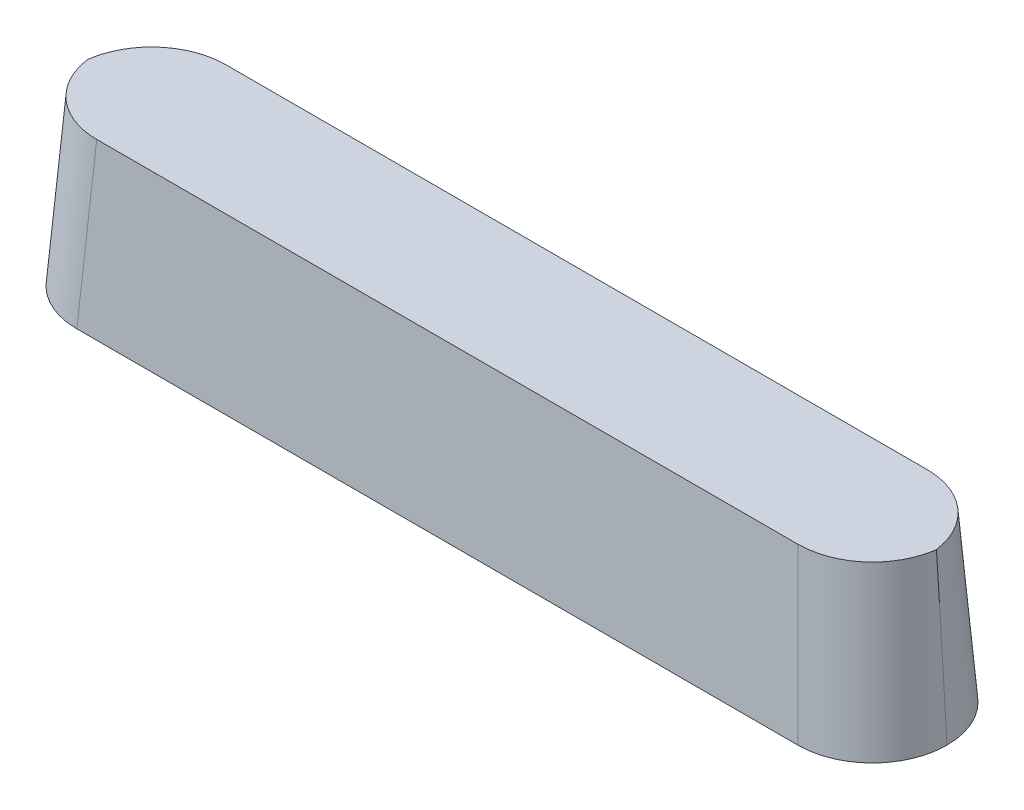
from build123d import *

# Parameters (mm, degrees)
FILLET_1_R = 15


with BuildPart() as part:
    # 草图1 → 放样1 section 0
    with BuildSketch(Plane(origin=(0, 0, 0), x_dir=(1, 0, 0), z_dir=(0, 1, 0))):
        with BuildLine():
            Line((87.50000000000003, -14.999999999999991), (-87.49999999999997, -15.000000000000012))
            Line((-87.49999999999997, -15.000000000000012), (-87.49999999999997, 14.999999999999986))
            Line((-87.49999999999997, 14.999999999999986), (87.50000000000003, 15.000000000000007))
            Line((87.50000000000003, 15.000000000000007), (87.50000000000003, -14.999999999999991))
        make_face()
    # 草图2 → 放样1 section 1
    with BuildSketch(Plane(origin=(0, 33, 0), x_dir=(1, 0, 0), z_dir=(0, 1, 0))):
        with BuildLine():
            Line((85.50000000000001, 13.000000000000007), (-85.49999999999997, 13.000000000000007))
            Line((-85.49999999999997, 13.000000000000007), (-85.49999999999997, -12.999999999999991))
            Line((-85.49999999999997, -12.999999999999991), (85.50000000000001, -12.999999999999991))
            Line((85.50000000000001, -12.999999999999991), (85.50000000000001, 13.000000000000007))
        make_face()
    loft()

    # 圆角1
    # the kernel refuses this fillet: 15 mm, written as the material it takes off along each edge
    with BuildSketch(Plane(origin=(89.75615314494081, -37.226526891522596, -17.25615314494077), x_dir=(-0.99817518096122, -0.0602740731413001, -0.0036529741297753678), z_dir=(-0.06038466786391727, 0.9963470197546278, 0.06038466786391684))) as fillet_1_piece_1:
        with BuildLine():
            CenterArc((FILLET_1_R * 0.996347019755, FILLET_1_R), FILLET_1_R, 180.20968310121904, 89.79031689878093)
            Line((-FILLET_1_R * 0.00364628369535, FILLET_1_R * 0.996340347667), (0, 0))
            Line((0, 0), (FILLET_1_R * 0.996347019755, 1e-17))
        make_face()
    extrude(amount=107.84701680495597, mode=Mode.SUBTRACT)
    with BuildSketch(Plane(origin=(89.7561531449408, -37.226526891522376, 17.25615314494074), x_dir=(-0.9981751809612202, -0.06027407314129964, 0.003652974129776053), z_dir=(-0.06038466786391684, 0.9963470197546278, -0.06038466786391684))) as fillet_1_piece_2:
        with BuildLine():
            CenterArc((FILLET_1_R * 0.996347019755, -FILLET_1_R), FILLET_1_R, 89.99999999999999, 89.79031689878094)
            Line((-FILLET_1_R * 0.00364628369535, -FILLET_1_R * 0.996340347667), (0, 0))
            Line((0, 0), (FILLET_1_R * 0.996347019755, 0))
        make_face()
    extrude(amount=107.84701680495557, mode=Mode.SUBTRACT)
    with BuildSketch(Plane(origin=(-89.75615314494071, -37.226526891522205, -17.256153144940704), x_dir=(-0.0036529741297760742, -0.06027407314129905, 0.9981751809612202), z_dir=(0.06038466786391684, 0.9963470197546278, 0.06038466786391625))) as fillet_1_piece_3:
        with BuildLine():
            CenterArc((FILLET_1_R * 0.996347019755, FILLET_1_R), FILLET_1_R, 180.20968310121907, 89.79031689878093)
            Line((-FILLET_1_R * 0.00364628369535, FILLET_1_R * 0.996340347667), (0, 0))
            Line((0, 0), (FILLET_1_R * 0.996347019755, -1e-17))
        make_face()
    extrude(amount=107.84701680495523, mode=Mode.SUBTRACT)
    with BuildSketch(Plane(origin=(-89.75615314494074, -37.22652689152266, 17.256153144940804), x_dir=(0.99817518096122, -0.060274073141299664, 0.0036529741297756076), z_dir=(0.06038466786391684, 0.9963470197546278, -0.06038466786391748))) as fillet_1_piece_4:
        with BuildLine():
            CenterArc((FILLET_1_R * 0.996347019755, FILLET_1_R), FILLET_1_R, 180.20968310121904, 89.79031689878093)
            Line((-FILLET_1_R * 0.00364628369535, FILLET_1_R * 0.996340347667), (0, 0))
            Line((0, 0), (FILLET_1_R * 0.996347019755, 0))
        make_face()
    extrude(amount=107.84701680495613, mode=Mode.SUBTRACT)


solid = part.part
